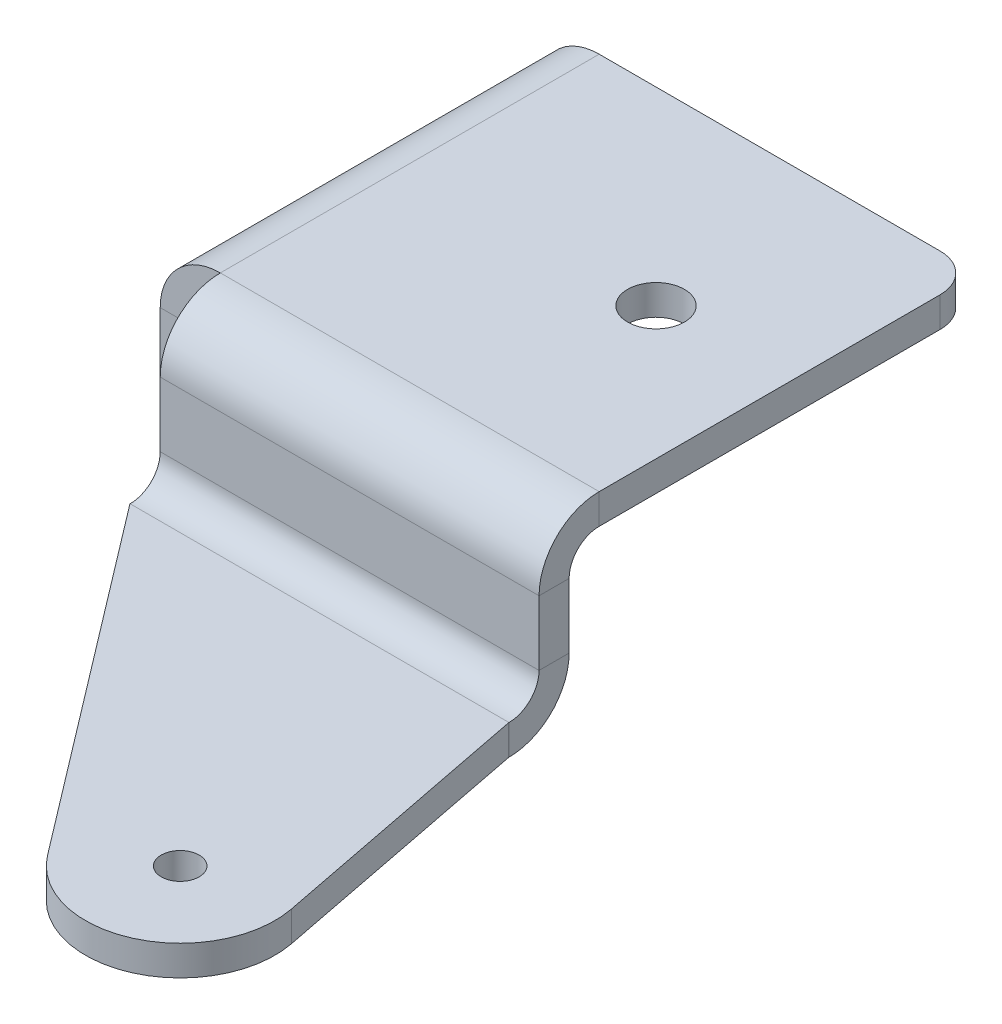
from build123d import *

# Parameters (mm, degrees)
SKETCH2_W                = 20
SKETCH2_H                = 20
BOSS_EXTRUDE1_DEPTH      = 1.27
HOLE1_OUTLINE_R          = 1.5
HOLE1_DEPTH              = 1.27
CONVERT_SOLID3_START     = -0.3175
CONVERT_SOLID3_OUTLINE_W = 20
CONVERT_SOLID3_OUTLINE_H = 20
CONVERT_SOLID3_OUTLINE_R = 1.5
CONVERT_SOLID3_DEPTH     = 0.3175
EDGE_FLANGE1_DEPTH       = 20
CUT_EXTRUDE1_REACH       = 40.263
SKETCH25_R               = 6.25
EDGE_FLANGE3_DEPTH       = 20
EDGE_FLANGE4_DEPTH       = 20
SKETCH31_R               = 1
BOSS_EXTRUDE2_DEPTH      = 1.5875
FILLET1_R                = 2


# Read off the part's stored shape, not the designer's step: Hole1, Convert-Solid3
# Sheet-metal steps are written as plain solids
with BuildPart() as part:
    # Sketch2 → Boss-Extrude1 (new body)
    with BuildSketch(Plane(origin=(0, 0, 0), x_dir=(1, 0, 0), z_dir=(0, 1, 0))):
        with Locations((10, 10)):
            Rectangle(SKETCH2_W, SKETCH2_H)
    extrude(amount=BOSS_EXTRUDE1_DEPTH)

    # Hole1 outline → Hole1 (cut)
    with BuildSketch(Plane(origin=(0, 0, 0), x_dir=(1, 0, 0), z_dir=(0, 1, 0))):
        with Locations((13, 10)):
            Circle(HOLE1_OUTLINE_R)
    extrude(amount=HOLE1_DEPTH, mode=Mode.SUBTRACT)

    # Convert-Solid3 outline → Convert-Solid3 (add)
    with BuildSketch(Plane(origin=(0, 0, 0), x_dir=(1, 0, 0), z_dir=(0, 1, 0)).offset(CONVERT_SOLID3_START)):
        with Locations((10, 10)):
            Rectangle(CONVERT_SOLID3_OUTLINE_W, CONVERT_SOLID3_OUTLINE_H)
        with Locations((13, 10)):
            Circle(CONVERT_SOLID3_OUTLINE_R, mode=Mode.SUBTRACT)
    extrude(amount=CONVERT_SOLID3_DEPTH)

    # Edge-Flange1 section (across the edge) → Edge-Flange1 (add)
    with BuildSketch(Plane(origin=(-1.5875, -0.3175, 0), x_dir=(1, 0, 0), z_dir=(0, 0, -1))):
        with BuildLine():
            Line((-1.5875, 1.5875), (-1.5875, 24.1375))
            Line((-1.5875, 24.1375), (0, 24.1375))
            Line((0, 24.1375), (0, 1.5875))
            ThreePointArc((0, 1.5875), (0.464967985, 0.464967985), (1.5875, 0))
            Line((1.5875, 0), (1.5875, -1.5875))
            ThreePointArc((1.5875, -1.5875), (-0.65756403, -0.65756403), (-1.5875, 1.5875))
        make_face()
    extrude(amount=EDGE_FLANGE1_DEPTH)

    # Sketch25 → Cut-Extrude1 (cut, up to next)
    with BuildSketch(Plane(origin=(-1.5875, 0, 0), x_dir=(0, 0, -1), z_dir=(1, 0, 0)), mode=Mode.PRIVATE) as cut_extrude1_sk1:
        with Locations(Location((10, -13.18, 0), (0, 0, 90))):
            Circle(SKETCH25_R)
    cut_extrude1_tool1 = extrude(cut_extrude1_sk1.sketch, amount=-CUT_EXTRUDE1_REACH, mode=Mode.PRIVATE) & part.part
    add(cut_extrude1_tool1.solids().sort_by_distance((-1.5875, -13.18, -10))[0], mode=Mode.SUBTRACT)

    # Edge-Flange3 section (across the edge) → Edge-Flange3 (add)
    with BuildSketch(Plane(origin=(20, -0.3175, 1.5875), x_dir=(0, 0, -1), z_dir=(-1, 0, 0))):
        with BuildLine():
            Line((-1.5875, 1.5875), (-1.5875, 5))
            Line((-1.5875, 5), (0, 5))
            Line((0, 5), (0, 1.5875))
            ThreePointArc((0, 1.5875), (0.464967985, 0.464967985), (1.5875, 0))
            Line((1.5875, 0), (1.5875, -1.5875))
            ThreePointArc((1.5875, -1.5875), (-0.65756403, -0.65756403), (-1.5875, 1.5875))
        make_face()
    extrude(amount=EDGE_FLANGE3_DEPTH)

    # Edge-Flange4 section (across the edge) → Edge-Flange4 (add)
    with BuildSketch(Plane(origin=(0, -6.905, 3.175), x_dir=(0, 1, 0), z_dir=(1, 0, 0))):
        with BuildLine():
            Line((-1.5875, 1.5875), (-1.5875, 1.6))
            Line((-1.5875, 1.6), (0, 1.6))
            Line((0, 1.6), (0, 1.5875))
            ThreePointArc((0, 1.5875), (0.464967985, 0.464967985), (1.5875, 0))
            Line((1.5875, 0), (1.5875, -1.5875))
            ThreePointArc((1.5875, -1.5875), (-0.65756403, -0.65756403), (-1.5875, 1.5875))
        make_face()
    extrude(amount=EDGE_FLANGE4_DEPTH)

    # Sketch31 → Boss-Extrude2 (add)
    with BuildSketch(Plane(origin=(0, -6.905, 0), x_dir=(1, 0, 0), z_dir=(0, 1, 0))):
        with BuildLine():
            Line((20, -4.775), (0, -4.775))
            Line((0, -4.775), (13.901931499, -23.029367025))
            ThreePointArc((13.901931499, -23.029367025), (19.927179344, -24.561576399), (22.7869765, -19.041355625))
            Line((22.7869765, -19.041355625), (20, -4.775))
        make_face()
        with Locations(Location((17.879736852, -20, 0), (0, 0, 270))):
            Circle(SKETCH31_R, mode=Mode.SUBTRACT)
    extrude(amount=-BOSS_EXTRUDE2_DEPTH)

    # Fillet1
    fillet1_edges = [part.edges().sort_by_distance(p)[0] for p in [
        (20, 0.47625, -20),
        (-2.38125, -24.455, 0),
        (-2.38125, -24.455, -20),
    ]]
    fillet(fillet1_edges, radius=FILLET1_R)


solid = part.part
